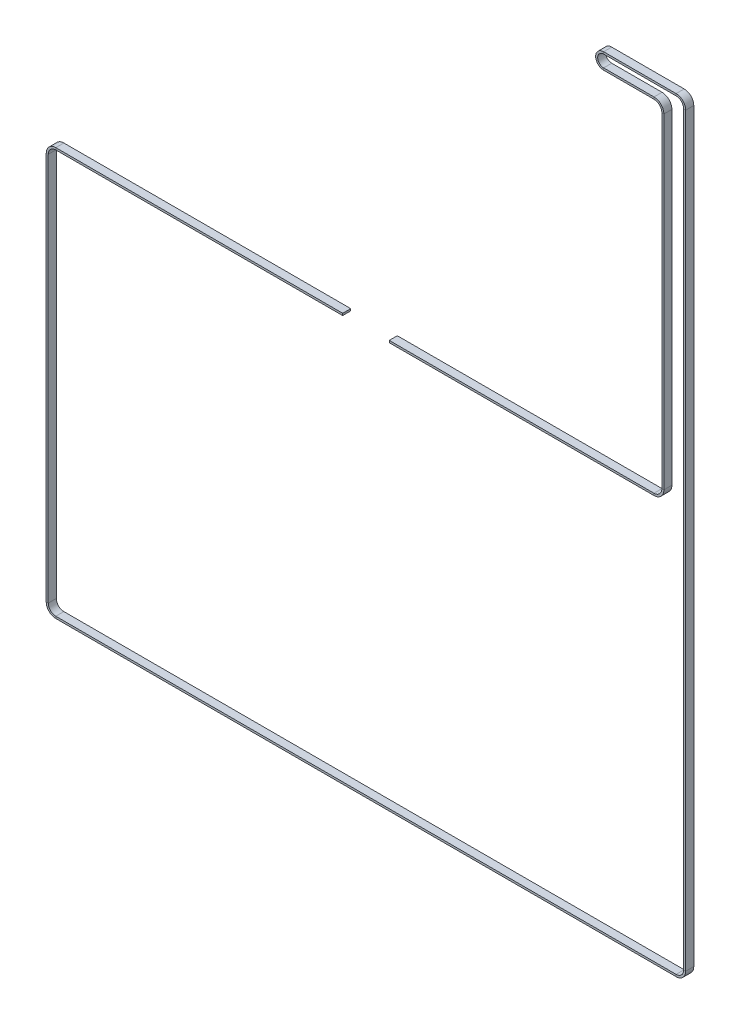
from build123d import *

# Parameters (mm, degrees)
SKETCH4_W = 6
SKETCH4_H = 1.5


with BuildPart() as part:
    # Sweep1: sweep along a path in Sketch1
    with BuildLine(Plane.XY.offset(2.2)) as sweep1_path:
        Line((182.962225973, -408.135411885), (-30.687774027, -408.135411885))
        ThreePointArc((-30.687774027, -408.135411885), (-35.195579767, -410.002606159), (-37.062774041, -414.510411899))
        Line((-37.062774041, -414.510411899), (-37.062774041, -703.985411885))
        ThreePointArc((-37.062774041, -703.985411885), (-35.195579771, -708.493217615), (-30.687774041, -710.360411885))
        Line((-30.687774041, -710.360411885), (431.312225959, -710.360411885))
        ThreePointArc((431.312225959, -710.360411885), (435.820031689, -708.493217615), (437.687225959, -703.985411885))
        Line((437.687225959, -703.985411885), (437.687225959, -148.660411885))
        ThreePointArc((437.687225959, -148.660411885), (435.820031689, -144.152606155), (431.312225959, -142.285411885))
        Line((431.312225959, -142.285411885), (377.312225959, -142.285411885))
        ThreePointArc((377.312225959, -142.285411885), (372.112225959, -147.485411885), (377.312225959, -152.685411885))
        Line((377.312225959, -152.685411885), (414.812225959, -152.685411885))
        ThreePointArc((414.812225959, -152.685411885), (419.479130714, -154.618507129), (421.412225959, -159.285411885))
        Line((421.412225959, -159.285411885), (421.412225959, -401.685411899))
        ThreePointArc((421.412225959, -401.685411899), (419.479130719, -406.352316645), (414.812225973, -408.285411885))
        Line((414.812225973, -408.285411885), (217.662225973, -408.285411885))
    # Sketch4 → Sweep1 (sweep)
    with BuildSketch(Plane(origin=(182.962225973, -408.135411885, 2.2), x_dir=(0, 0, -1), z_dir=(1, 0, 0))):
        Rectangle(SKETCH4_W, SKETCH4_H)
    sweep(path=sweep1_path.line)


solid = part.part
